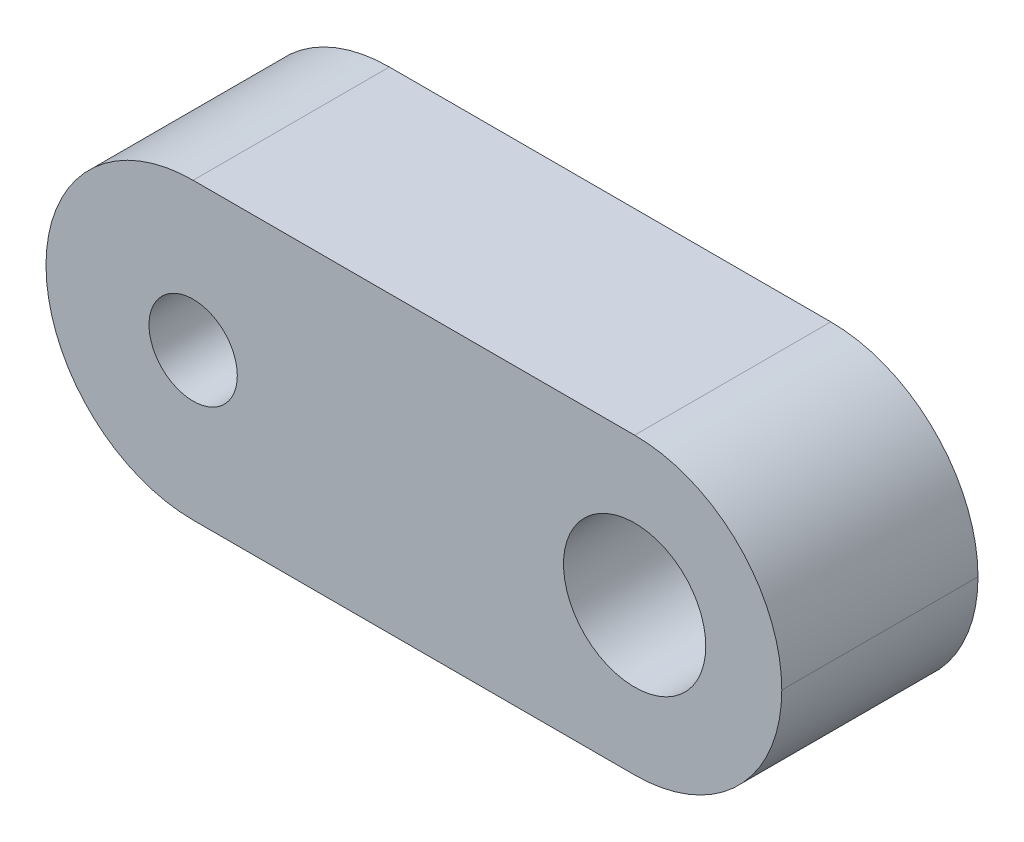
from build123d import *

# Parameters (mm, degrees)
SKETCH1_W               = 15
SKETCH1_H               = 6
BOSS_EXTRUDE1_DEPTH     = 4
CUT_EXTRUDE1_DEPTH      = 17.643316977
CUT_EXTRUDE1_DEPTH_BACK = 17.643316977
SKETCH2_R               = 0.9
SKETCH2_R_2             = 1.45
FILLET1_R               = 3


with BuildPart() as part:
    # Sketch1 → Boss-Extrude1 (new body)
    with BuildSketch(Plane.XY):
        with Locations((7.5, -3)):
            Rectangle(SKETCH1_W, SKETCH1_H)
    extrude(amount=BOSS_EXTRUDE1_DEPTH)

    # Sketch2 → Cut-Extrude1 (cut, two sides: drawn at the far end of the back side and taken through both)
    with BuildSketch(Plane.XY.offset(4).offset(-CUT_EXTRUDE1_DEPTH_BACK)):
        with Locations((3, -3)):
            Circle(SKETCH2_R)
        with Locations((12, -3)):
            Circle(SKETCH2_R_2)
    extrude(amount=CUT_EXTRUDE1_DEPTH + CUT_EXTRUDE1_DEPTH_BACK, mode=Mode.SUBTRACT)

    # Fillet1
    fillet1_edges = [part.edges().sort_by_distance(p)[0] for p in [
        (15, -6, 2),
        (15, 0, 2),
        (0, -6, 2),
        (0, 0, 2),
    ]]
    fillet(fillet1_edges, radius=FILLET1_R - 0.0001)  # a hair under: the kernel refuses the full size


solid = part.part
